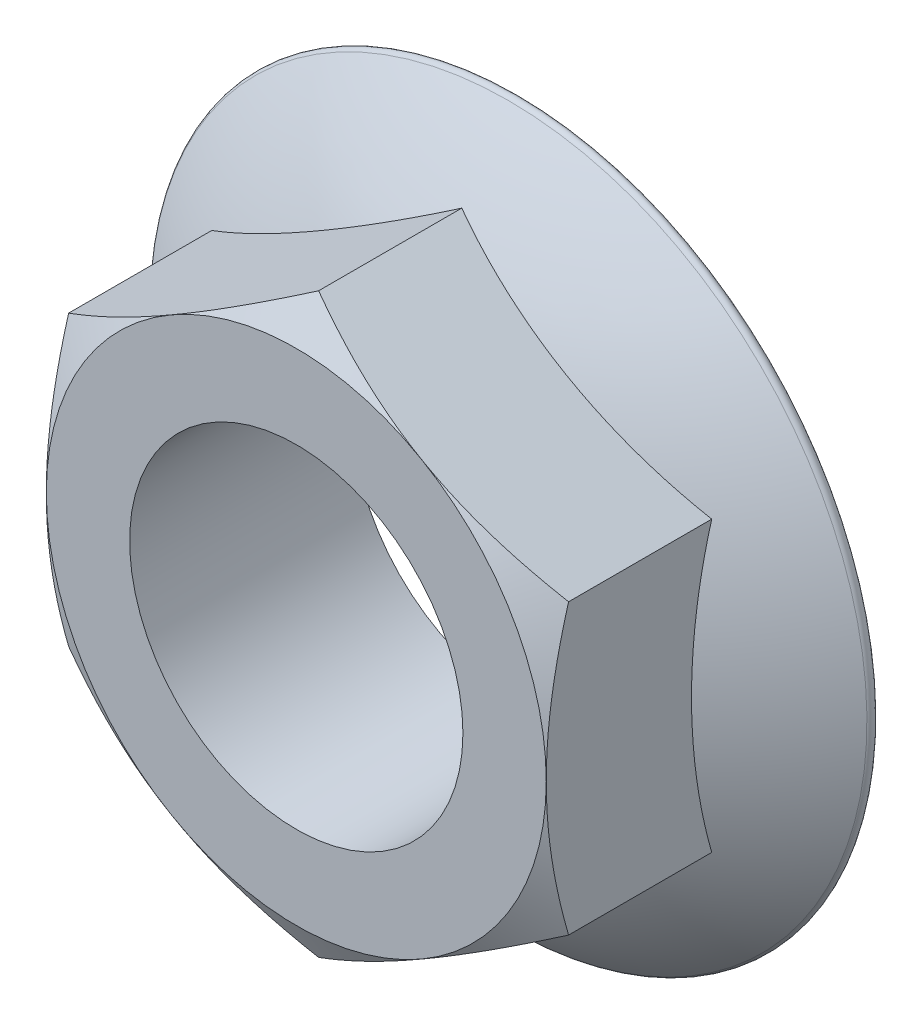
from build123d import *

# Parameters (mm, degrees)
BOSS_EXTRUDE1_DEPTH = 20
SKETCH3_OUTSIDE_W   = 154.97
SKETCH3_OUTSIDE_H   = 154.97
SKETCH3_OUTSIDE_R   = 22.5
CUT_EXTRUDE1_DEPTH  = 20
CUT_EXTRUDE1_DRAFT  = -60
SKETCH4_R           = 15
CUT_EXTRUDE2_DEPTH  = 51.060014113


with BuildPart() as part:
    # Sketch1 → Boss-Extrude1 (new body)
    with BuildSketch(Plane.XY):
        Polygon((22.5, -12.990381057), (22.5, 12.990381057), (0, 25.980762114), (-22.5, 12.990381057), (-22.5, -12.990381057), (0, -25.980762114), align=None)
    extrude(amount=BOSS_EXTRUDE1_DEPTH)

    # Sketch2 → Revolve1 (revolve)
    with BuildSketch(Plane(origin=(0, 0, 0), x_dir=(0, 0, -1), z_dir=(1, 0, 0))):
        with BuildLine():
            Line((0, 0), (-12, 0))
            ThreePointArc((-12, 0), (-9.145772075, -17.058051419), (-0.894027207, -32.257802794))
            ThreePointArc((-0.894027207, -32.257802794), (-0.337232687, -32.42276506), (0, -31.95))
            Line((0, -31.95), (0, 0))
        make_face()
    revolve(axis=Axis((0, 0, 0), (0, 0, 1)))


with BuildPart() as cut_extrude1_tool:
    # Sketch3 outside → Cut-Extrude1 (with draft: the straight prism first)
    with BuildSketch(Plane.XY.offset(20)):
        Rectangle(SKETCH3_OUTSIDE_W, SKETCH3_OUTSIDE_H)
        Circle(SKETCH3_OUTSIDE_R, mode=Mode.SUBTRACT)
    extrude(amount=-CUT_EXTRUDE1_DEPTH)
    # Cut-Extrude1: the draft: its side faces are tilted about the plane it starts from
    cut_extrude1_sides = [cut_extrude1_tool.faces().sort_by_distance(p)[0] for p in [
        (0, -77.485, 10),
        (77.485, 0, 10),
        (0, 77.485, 10),
        (-77.485, 0, 10),
        (-22.5, 0, 10),
    ]]
    draft(cut_extrude1_sides, Plane.XY.offset(20), CUT_EXTRUDE1_DRAFT)


with BuildPart() as part_1:
    add(part.part)

    # Cut-Extrude1: cut by cut_extrude1_tool
    add(cut_extrude1_tool.part, mode=Mode.SUBTRACT)

    # Sketch4 → Cut-Extrude2 (cut, through all)
    with BuildSketch(Plane.XY.offset(20)):
        Circle(SKETCH4_R)
    extrude(amount=-CUT_EXTRUDE2_DEPTH, mode=Mode.SUBTRACT)


solid = part_1.part
